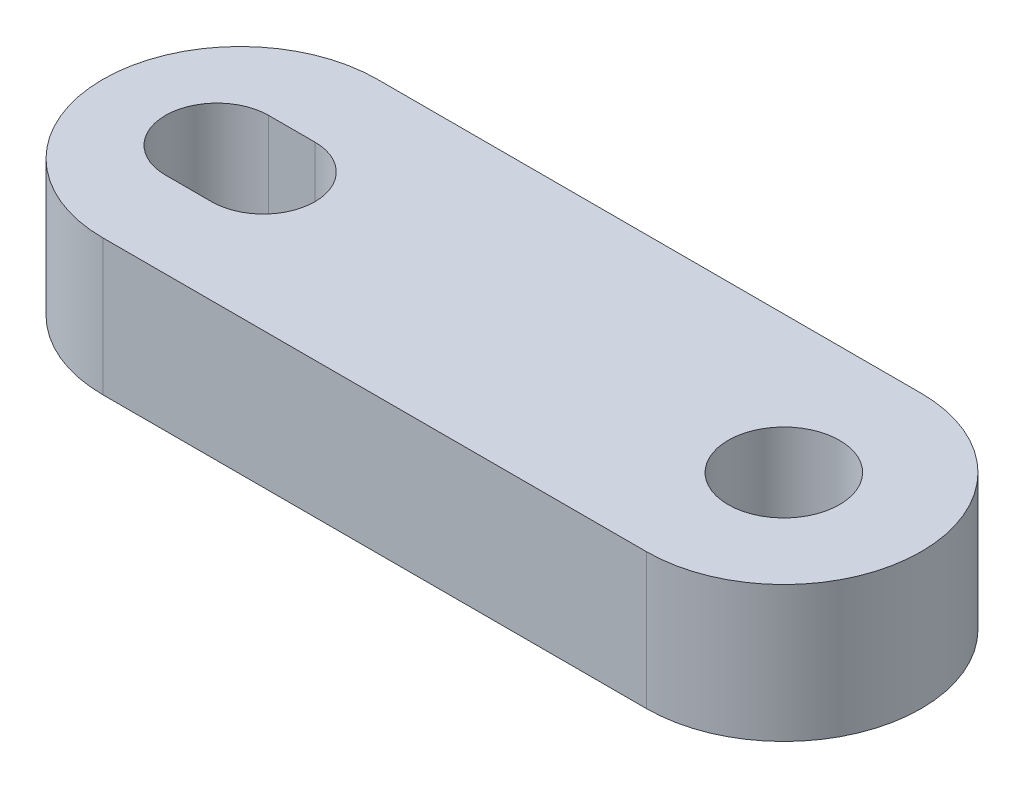
from build123d import *

# Parameters (mm, degrees)
SKETCH_1_R      = 2.05
EXTRUDE_1_DEPTH = 5


with BuildPart() as part:
    # 草圖1 → 填料-伸長1 (new body)
    with BuildSketch(Plane(origin=(0, 0, 0), x_dir=(1, 0, 0), z_dir=(0, 1, 0))):
        with BuildLine():
            Line((-10, 5.05), (10, 5.05))
            ThreePointArc((10, 5.05), (15.05, 0), (10, -5.05))
            Line((10, -5.05), (-10, -5.05))
            ThreePointArc((-10, -5.05), (-15.05, 0), (-10, 5.05))
        make_face()
        with Locations((10, 0)):
            Circle(SKETCH_1_R, mode=Mode.SUBTRACT)
        with BuildLine():
            Line((-10.85, 1.9), (-9.15, 1.9))
            ThreePointArc((-9.15, 1.9), (-7.25, 0), (-9.15, -1.9))
            Line((-9.15, -1.9), (-10.85, -1.9))
            ThreePointArc((-10.85, -1.9), (-12.75, 0), (-10.85, 1.9))
        make_face(mode=Mode.SUBTRACT)
    extrude(amount=EXTRUDE_1_DEPTH)


solid = part.part
